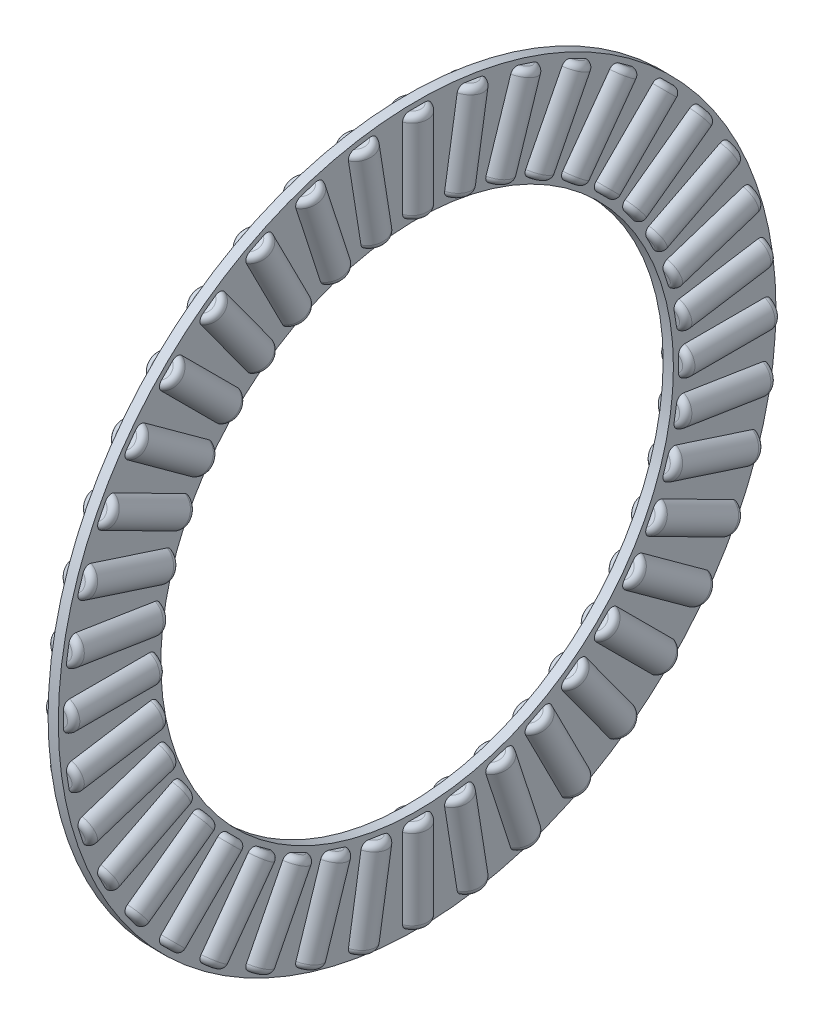
from build123d import *

# Parameters (mm, degrees)
CAGSPISKE_W           = 1
CAGSPISKE_H           = 10
ROLLERSDETAILED_COUNT = 40
ROLLERSDETAILED_ANGLE = 351


with BuildPart() as part:
    # CagSpiSke → CageSpine (revolve)
    with BuildSketch(Plane.XY):
        with Locations((0, 30)):
            Rectangle(CAGSPISKE_W, CAGSPISKE_H)
    revolve(axis=Axis((-34.925, 0, 0), (1, 0, 0)))

    # RolDetSke → RollerDetailed (revolve)
    with BuildSketch(Plane.XY):
        with BuildLine():
            Line((0, 34.5), (0.9, 34.5))
            ThreePointArc((0.9, 34.5), (1.324264069, 34.324264069), (1.5, 33.9))
            Line((1.5, 33.9), (1.5, 26.1))
            ThreePointArc((1.5, 26.1), (1.324264069, 25.675735931), (0.9, 25.5))
            Line((0.9, 25.5), (0, 25.5))
            Line((0, 25.5), (0, 34.5))
        make_face()
    rollerdetailed = revolve(axis=Axis((0, 33.02, 0), (0, 1, 0)))

    # RollersDetailed: RollerDetailed ×40 about axis
    rollersdetailed_axis = Axis((-50, 0, 0), (1, 0, 0))
    for i in range(1, ROLLERSDETAILED_COUNT):
        add(rollerdetailed.rotate(rollersdetailed_axis, i * ROLLERSDETAILED_ANGLE / (ROLLERSDETAILED_COUNT - 1)))


solid = part.part
